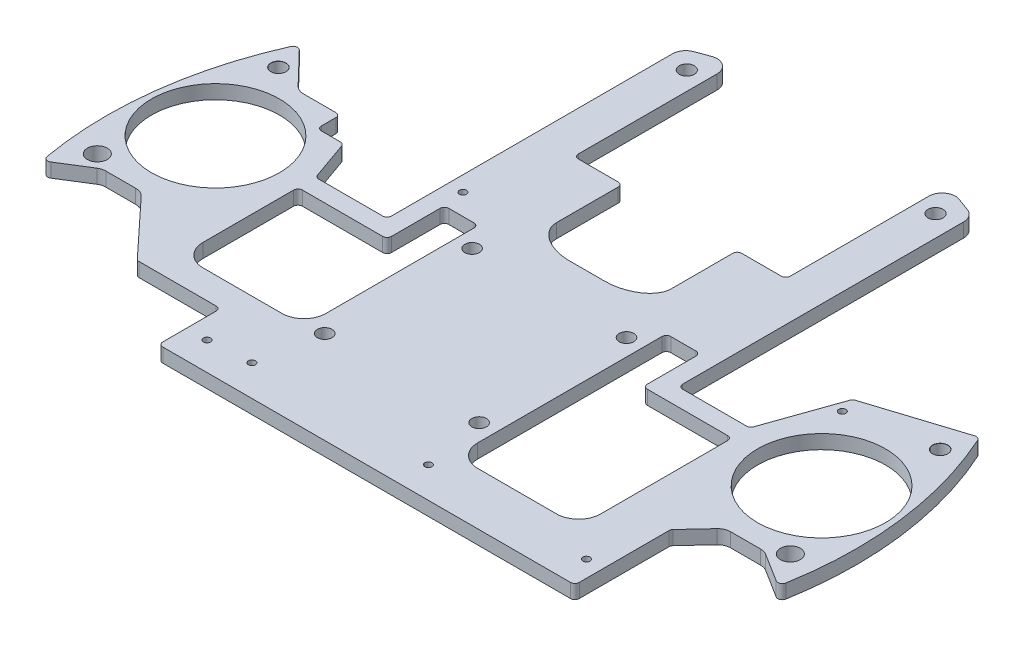
from build123d import *

# Parameters (mm, degrees)
BOSS_EXTRUDE1_OUTLINE_R        = 14.5
BOSS_EXTRUDE1_DEPTH            = 3.175
M4_CLEARANCE_HOLE1_D           = 4.5
F_3_3_3_3_DIAMETER_HOLE4_D     = 3.3
M3_CLEARANCE_HOLE2_D           = 3.4
M2X0_4_TAPPED_HOLE2_AT_2_COUNT = 2
M2X0_4_TAPPED_HOLE2_AT_2_PITCH = 86
M2X0_4_TAPPED_HOLE2_AT_3_COUNT = 2
M2X0_4_TAPPED_HOLE2_AT_3_PITCH = 103.730419839
M2X0_4_TAPPED_HOLE2_AT_4_COUNT = 2
M2X0_4_TAPPED_HOLE2_AT_4_PITCH = 58
FILLET1_R                      = 3
FILLET2_R                      = 1
FILLET3_SIZE                   = 6
FILLET3_SIZE_2                 = 9
FILLET4_R                      = 5
M3_CLEARANCE_HOLE1_D           = 3.4
M3_CLEARANCE_HOLE1_CSINK_D     = 3.45
M3_CLEARANCE_HOLE1_CSINK_ANGLE = 90
M2X0_4_TAPPED_HOLE1_D          = 1.6


with BuildPart() as part:
    # Boss-Extrude1: read off the stored shape, not the designer's step
    # Boss-Extrude1 outline → Boss-Extrude1 (new body)
    with BuildSketch(Plane(origin=(0, 0, 0), x_dir=(1, 0, 0), z_dir=(0, 1, 0))):
        with BuildLine():
            Line((33, 11.630595388), (33, 78.33262411))
            ThreePointArc((33, 78.33262411), (28.545123253, 80.063574355), (24, 81.541400528))
            Line((24, 81.541400528), (24, 45))
            Line((24, 45), (13, 45))
            Line((13, 45), (13, 24))
            Line((13, 24), (-13, 24))
            Line((-13, 24), (-13, 45))
            Line((-13, 45), (-24, 45))
            Line((-24, 45), (-24, 81.541400528))
            ThreePointArc((-24, 81.541400528), (-28.545123253, 80.063574355), (-33, 78.33262411))
            Line((-33, 78.33262411), (-33, 11.630595388))
            Line((-33, 11.630595388), (-49.185297029, 11.630595388))
            Line((-49.185297029, 11.630595388), (-52.624325057, 21.384301413))
            Line((-52.624325057, 21.384301413), (-58.624325057, 21.384301413))
            Line((-58.624325057, 21.384301413), (-58.624325057, 26.630595388))
            Line((-58.624325057, 26.630595388), (-68.191318528, 26.630595388))
            Line((-68.191318528, 26.630595388), (-77.073860284, 35.841596796))
            ThreePointArc((-77.073860284, 35.841596796), (-84.367778143, 10.347850562), (-83.451078309, -16.152941807))
            Line((-83.451078309, -16.152941807), (-75.073268231, -10.906716078))
            Line((-75.073268231, -10.906716078), (-66.121429656, -10.906716078))
            Line((-66.121429656, -10.906716078), (-53.091566877, -24.906716078))
            Line((-53.091566877, -24.906716078), (-34.205297029, -24.906716078))
            Line((-34.205297029, -24.906716078), (-34.205297029, -39))
            Line((-34.205297029, -39), (60.196181169, -39))
            Line((60.196181169, -39), (60.196181169, -17.27312839))
            Line((60.196181169, -17.27312839), (66.121429656, -10.906716078))
            Line((66.121429656, -10.906716078), (75.073268231, -10.906716078))
            Line((75.073268231, -10.906716078), (83.451078309, -16.152941807))
            ThreePointArc((83.451078309, -16.152941807), (84.367778143, 10.347850562), (77.073860284, 35.841596796))
            Line((77.073860284, 35.841596796), (55.268726082, 28.884301413))
            Line((55.268726082, 28.884301413), (49.185297029, 11.630595388))
            Line((49.185297029, 11.630595388), (33, 11.630595388))
        make_face()
        with Locations((-68.685297029, 8.424)):
            Circle(BOSS_EXTRUDE1_OUTLINE_R, mode=Mode.SUBTRACT)
        Polygon((-49.185297029, -18.906716078), (-49.185297029, 7.630595388), (-29, 7.630595388), (-29, 20.630595388), (-21.3, 20.630595388), (-21.3, -18.906716078), align=None, mode=Mode.SUBTRACT)
        Polygon((29, 20.630595388), (29, 7.630595388), (49.185297029, 7.630595388), (49.185297029, -27.138060345), (21.3, -27.138060345), (21.3, 20.630595388), align=None, mode=Mode.SUBTRACT)
        with Locations((68.685297029, 8.424)):
            Circle(BOSS_EXTRUDE1_OUTLINE_R, mode=Mode.SUBTRACT)
    extrude(amount=BOSS_EXTRUDE1_DEPTH)

    # M4 Clearance Hole1 (through all)
    with Locations(Plane(origin=(0, 3.175, 0), x_dir=(1, 0, 0), z_dir=(0, 1, 0))):
        with Locations((-78.54120923, -8.5016735), (78.54120923, -8.5016735)):
            Hole(M4_CLEARANCE_HOLE1_D / 2)

    # Ø3.3 (3.3) Diameter Hole4 (through all)
    with Locations(Plane(origin=(0, 3.175, 0), x_dir=(1, 0, 0), z_dir=(0, 1, 0))):
        with Locations((17.5, 15.4), (-17.5, -18), (-17.5, 15.4), (17.5, -18)):
            Hole(F_3_3_3_3_DIAMETER_HOLE4_D / 2)

    # M3 Clearance Hole2 (through all)
    with Locations(Plane(origin=(0, 3.175, 0), x_dir=(1, 0, 0), z_dir=(0, 1, 0))):
        with Locations((28.19, 74.751400528), (-28.19, 74.751400528)):
            Hole(M3_CLEARANCE_HOLE2_D / 2)

    # Sketch15 → M2x0.4 Tapped Hole2 (revolve, cut)
    with BuildSketch(Plane(origin=(-29.558455866, 3.175, -25.380595388), x_dir=(0, 0, 1), z_dir=(1, 0, 0))):
        Polygon((0, 0), (0, 3.175), (1.5, 3.175), (0.8, 2.475), (0.8, 0), align=None)
    m2x0_4_tapped_hole2 = revolve(axis=Axis((-29.558455866, 9.525, -25.380595388), (0, -1, 0)), mode=Mode.SUBTRACT)

    # M2x0.4 Tapped Hole2 at 2: M2x0.4 Tapped Hole2 ×2
    with Locations(*[(i * M2X0_4_TAPPED_HOLE2_AT_2_PITCH, 0, 0) for i in range(1, M2X0_4_TAPPED_HOLE2_AT_2_COUNT)]):
        add(m2x0_4_tapped_hole2, mode=Mode.SUBTRACT)

    # M2x0.4 Tapped Hole2 at 3: M2x0.4 Tapped Hole2 ×2
    with Locations(*[Vector(0.8290721288256765, 0, 0.5591416682777818) * (i * M2X0_4_TAPPED_HOLE2_AT_3_PITCH) for i in range(1, M2X0_4_TAPPED_HOLE2_AT_3_COUNT)]):
        add(m2x0_4_tapped_hole2, mode=Mode.SUBTRACT)

    # M2x0.4 Tapped Hole2 at 4: M2x0.4 Tapped Hole2 ×2
    with Locations(*[(0, 0, i * M2X0_4_TAPPED_HOLE2_AT_4_PITCH) for i in range(1, M2X0_4_TAPPED_HOLE2_AT_4_COUNT)]):
        add(m2x0_4_tapped_hole2, mode=Mode.SUBTRACT)

    # Fillet1
    fillet1_edges = [part.edges().sort_by_distance(p)[0] for p in [
        (75.073268231, 1.5875, 10.906716078),
        (66.121429656, 1.5875, 10.906716078),
        (-66.121429656, 1.5875, 10.906716078),
        (-75.073268231, 1.5875, 10.906716078),
        (-68.191318528, 1.5875, -26.630595388),
        (-33, 1.5875, -78.33262411),
        (-24, 1.5875, -81.541400528),
        (24, 1.5875, -81.541400528),
        (33, 1.5875, -78.33262411),
    ]]
    fillet(fillet1_edges, radius=FILLET1_R)

    # Fillet2
    fillet2_edges = [part.edges().sort_by_distance(p)[0] for p in [
        (33, 1.5875, -11.630595388),
        (49.185297029, 1.5875, -11.630595388),
        (55.268726082, 1.5875, -28.884301413),
        (77.073860284, 1.5875, -35.841596796),
        (83.451078309, 1.5875, 16.152941807),
        (60.196181169, 1.5875, 17.27312839),
        (60.196181169, 1.5875, 39),
        (-34.205297029, 1.5875, 39),
        (-34.205297029, 1.5875, 24.906716078),
        (-53.091566877, 1.5875, 24.906716078),
        (-83.451078309, 1.5875, 16.152941807),
        (-77.073860284, 1.5875, -35.841596796),
        (-58.624325057, 1.5875, -26.630595388),
        (-58.624325057, 1.5875, -21.384301413),
        (-52.624325057, 1.5875, -21.384301413),
        (-49.185297029, 1.5875, -11.630595388),
        (-33, 1.5875, -11.630595388),
        (-24, 1.5875, -45),
        (-13, 1.5875, -45),
        (13, 1.5875, -45),
        (24, 1.5875, -45),
        (-49.185297029, 1.5875, -7.630595388),
        (-21.3, 1.5875, -20.630595388),
        (-29, 1.5875, -20.630595388),
        (-29, 1.5875, -7.630595388),
        (29, 1.5875, -20.630595388),
        (21.3, 1.5875, -20.630595388),
        (49.185297029, 1.5875, -7.630595388),
        (29, 1.5875, -7.630595388),
    ]]
    fillet(fillet2_edges, radius=FILLET2_R)

    # Fillet3
    # a fillet whose section is not a circle: 9, 6 mm, written as the material it adds along each edge
    with BuildSketch(Plane(origin=(13, 0, -24), x_dir=(0, 0, -1), z_dir=(0, 1, 0))) as fillet3_piece_1:
        with BuildLine():
            Bezier((FILLET3_SIZE, 0), (0, 0), (0, FILLET3_SIZE_2), weights=[1, 0.666666667, 1])
            Line((0, FILLET3_SIZE_2), (0, 0))
            Line((0, 0), (FILLET3_SIZE, 0))
        make_face()
    extrude(amount=3.175)
    with BuildSketch(Plane(origin=(-13, 0, -24), x_dir=(1, 0, 0), z_dir=(0, 1, 0))) as fillet3_piece_2:
        with BuildLine():
            Bezier((FILLET3_SIZE_2, 0), (0, 0), (0, FILLET3_SIZE), weights=[1, 0.666666667, 1])
            Line((0, FILLET3_SIZE), (0, 0))
            Line((0, 0), (FILLET3_SIZE_2, 0))
        make_face()
    extrude(amount=3.175)

    # Fillet4
    fillet4_edges = [part.edges().sort_by_distance(p)[0] for p in [
        (-49.185297029, 1.5875, 18.906716078),
        (-21.3, 1.5875, 18.906716078),
        (21.3, 1.5875, 27.138060345),
        (49.185297029, 1.5875, 27.138060345),
    ]]
    fillet(fillet4_edges, radius=FILLET4_R)

    # M3 Clearance Hole1 (through all)
    with Locations(Plane(origin=(0, 3.175, 0), x_dir=(1, 0, 0), z_dir=(0, 1, 0))):
        with Locations((75, 29), (-75, 29)):
            CounterSinkHole(M3_CLEARANCE_HOLE1_D / 2, M3_CLEARANCE_HOLE1_CSINK_D / 2, counter_sink_angle=M3_CLEARANCE_HOLE1_CSINK_ANGLE)

    # M2x0.4 Tapped Hole1 (through all)
    with Locations(Plane(origin=(0, 3.175, 0), x_dir=(1, 0, 0), z_dir=(0, 1, 0))):
        with Locations((-20, -32), (20, -32)):
            Hole(M2X0_4_TAPPED_HOLE1_D / 2)


solid = part.part
